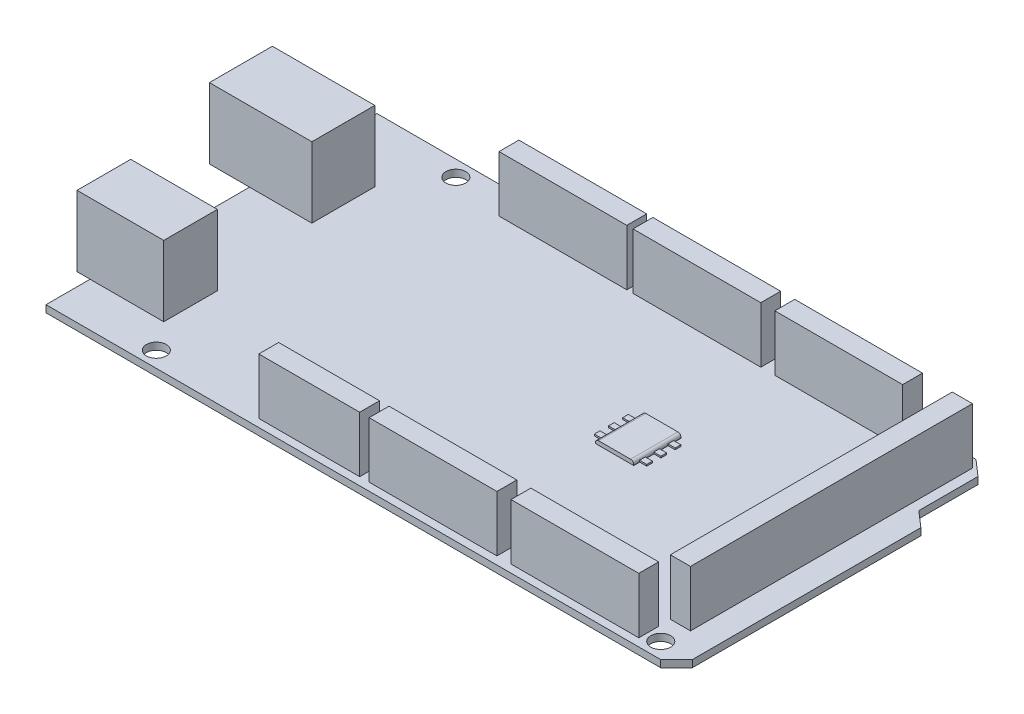
from build123d import *

# Parameters (mm, degrees)
SKETCH2_W           = 101.6
SKETCH2_H           = 53.34
BOSS_EXTRUDE1_DEPTH = 1.14
SKETCH3_R           = 1.6
CUT_EXTRUDE1_DEPTH  = 115.756329673
SKETCH4_W           = 20.59
SKETCH4_H           = 3.2
SKETCH4_W_2         = 16.256
BOSS_EXTRUDE2_DEPTH = 9
CUT_EXTRUDE2_DEPTH  = 116.10306512
SKETCH6_R           = 1.6
CUT_EXTRUDE3_DEPTH  = 116.10306512
SKETCH7_W           = 3.245231175
SKETCH7_H           = 45.43323645
BOSS_EXTRUDE3_DEPTH = 9
SKETCH8_W           = 16.51
SKETCH8_H           = 10.150135712
SKETCH8_W_2         = 13.97
SKETCH8_H_2         = 8.650400862
BOSS_EXTRUDE4_DEPTH = 11.36
SKETCH9_R           = 3.217681585
SKETCH9_R_2         = 1.182707285
CUT_EXTRUDE4_DEPTH  = 11.36
SKETCH10_W          = 6.35
SKETCH10_H          = 5.56209116
SKETCH10_W_2        = 5.200759748
SKETCH10_H_2        = 1.452464435
CUT_EXTRUDE5_DEPTH  = 11.36
CHAMFER1_SIZE       = 1.524
SKETCH11_W          = 6.176206758
SKETCH11_H          = 7.62
BOSS_EXTRUDE5_DEPTH = 0.635
SKETCH12_W          = 8.456815018
SKETCH12_H          = 0.915706085
BOSS_EXTRUDE6_DEPTH = 0.254
FILLET1_R           = 0.508


with BuildPart() as part:
    # Sketch2 → Boss-Extrude1 (new body)
    with BuildSketch(Plane(origin=(0, 0, 0), x_dir=(1, 0, 0), z_dir=(0, 1, 0))):
        with Locations((50.8, 26.67)):
            Rectangle(SKETCH2_W, SKETCH2_H)
    extrude(amount=BOSS_EXTRUDE1_DEPTH)

    # Sketch3 → Cut-Extrude1 (cut, through all)
    with BuildSketch(Plane(origin=(0, 1.14, 0), x_dir=(1, 0, 0), z_dir=(0, 1, 0))):
        with Locations(Location((15.24, 50.8, 0), (0, 0, 270))):
            Circle(SKETCH3_R)
        with Locations(Location((15.24, 2.54, 0), (0, 0, 90))):
            Circle(SKETCH3_R)
    extrude(amount=-CUT_EXTRUDE1_DEPTH, mode=Mode.SUBTRACT)

    # Sketch4 → Boss-Extrude2 (add)
    with BuildSketch(Plane(origin=(0, 1.14, 0), x_dir=(1, 0, 0), z_dir=(0, 1, 0))):
        with Locations((56.015, 50.47)):
            Rectangle(SKETCH4_W, SKETCH4_H)
        with Locations((34.425, 50.47)):
            Rectangle(SKETCH4_W, SKETCH4_H)
        with Locations((78.875, 50.47)):
            Rectangle(SKETCH4_W, SKETCH4_H)
        with Locations((83.955, 2.87)):
            Rectangle(SKETCH4_W, SKETCH4_H)
        with Locations((61.095, 2.87)):
            Rectangle(SKETCH4_W, SKETCH4_H)
        with Locations((41.148, 2.87)):
            Rectangle(SKETCH4_W_2, SKETCH4_H)
    extrude(amount=BOSS_EXTRUDE2_DEPTH)

    # Sketch5 → Cut-Extrude2 (cut, through all)
    with BuildSketch(Plane(origin=(0, 1.14, 0), x_dir=(1, 0, 0), z_dir=(0, 1, 0))):
        Polygon((99.06, 0), (101.6, 0), (101.6, 2.54), align=None)
        Polygon((99.06, 41.584296227), (101.6, 39.37), (101.6, 53.321621524), (101.6, 53.34), (96.536046111, 53.34), (96.536046111, 53.321621524), (99.06, 51.121313818), align=None)
    extrude(amount=-CUT_EXTRUDE2_DEPTH, mode=Mode.SUBTRACT)

    # Sketch6 → Cut-Extrude3 (cut, through all)
    with BuildSketch(Plane(origin=(0, 1.14, 0), x_dir=(1, 0, 0), z_dir=(0, 1, 0))):
        with Locations(Location((96.52, 2.54, 0), (0, 0, 270))):
            Circle(SKETCH6_R)
        with Locations(Location((91.44, 50.8, 0), (0, 0, 270))):
            Circle(SKETCH6_R)
    extrude(amount=-CUT_EXTRUDE3_DEPTH, mode=Mode.SUBTRACT)

    # Sketch7 → Boss-Extrude3 (add)
    with BuildSketch(Plane(origin=(0, 1.14, 0), x_dir=(1, 0, 0), z_dir=(0, 1, 0))):
        with Locations((95.826679511, 29.119940639)):
            Rectangle(SKETCH7_W, SKETCH7_H)
    extrude(amount=BOSS_EXTRUDE3_DEPTH)

    # Sketch8 → Boss-Extrude4 (add)
    with BuildSketch(Plane(origin=(0, 1.14, 0), x_dir=(1, 0, 0), z_dir=(0, 1, 0))):
        with Locations((1.785, 37.873809091)):
            Rectangle(SKETCH8_W, SKETCH8_H)
        with Locations((4.885, 11.42677262)):
            Rectangle(SKETCH8_W_2, SKETCH8_H_2)
    extrude(amount=BOSS_EXTRUDE4_DEPTH)

    # Sketch9 → Cut-Extrude4 (cut)
    with BuildSketch(Plane.ZY.offset(2.1)):
        with Locations((-11.42677262, 7.870480003)):
            Circle(SKETCH9_R)
        with Locations((-11.42677262, 7.870480003)):
            Circle(SKETCH9_R_2, mode=Mode.SUBTRACT)
    extrude(amount=-CUT_EXTRUDE4_DEPTH, mode=Mode.SUBTRACT)

    # Sketch10 → Cut-Extrude5 (cut)
    with BuildSketch(Plane.ZY.offset(6.47)):
        with Locations((-37.873809091, 6.856773581)):
            Rectangle(SKETCH10_W, SKETCH10_H)
        with Locations((-37.84018947, 5.332133236)):
            Rectangle(SKETCH10_W_2, SKETCH10_H_2, mode=Mode.SUBTRACT)
    extrude(amount=-CUT_EXTRUDE5_DEPTH, mode=Mode.SUBTRACT)

    # Chamfer1
    chamfer1_edges = [part.edges().sort_by_distance(p)[0] for p in [
        (-0.79, 9.637819161, -41.048809091),
        (-0.79, 9.637819161, -34.698809091),
    ]]
    chamfer(chamfer1_edges, length=CHAMFER1_SIZE)

    # Sketch11 → Boss-Extrude5 (add)
    with BuildSketch(Plane(origin=(0, 1.14, 0), x_dir=(1, 0, 0), z_dir=(0, 1, 0))):
        with Locations((66.718103379, 28.71)):
            Rectangle(SKETCH11_W, SKETCH11_H)
    extrude(amount=BOSS_EXTRUDE5_DEPTH)

    # Sketch12 → Boss-Extrude6 (add)
    with BuildSketch(Plane(origin=(0, 1.14, 0), x_dir=(1, 0, 0), z_dir=(0, 1, 0))):
        with Locations((66.71021047, 28.609003409)):
            Rectangle(SKETCH12_W, SKETCH12_H)
        with Locations((66.71021047, 30.895003409)):
            Rectangle(SKETCH12_W, SKETCH12_H)
        with Locations((66.71021047, 26.323003408)):
            Rectangle(SKETCH12_W, SKETCH12_H)
    extrude(amount=BOSS_EXTRUDE6_DEPTH)

    # Fillet1
    # the kernel refuses this fillet: 0.508 mm, written as the material it takes off along each edge
    with BuildSketch(Plane(origin=(69.806206758, 1.775, -33.79), x_dir=(0, -1, 0), z_dir=(0, 0, 1))) as fillet1_piece_1_section:
        with BuildLine():
            CenterArc((FILLET1_R, -FILLET1_R), FILLET1_R, 90, 90)
            Line((0, -FILLET1_R), (0, 0))
            Line((0, 0), (FILLET1_R, 0))
        make_face()
    fillet1_piece_1 = extrude(amount=10.16, mode=Mode.PRIVATE)
    fillet1_piece_1 = split(fillet1_piece_1, bisect_by=Plane(origin=(69.801380886, 1.362351692, -31.352856451), z_dir=(0, 0, -1)), keep=Keep.TOP, mode=Mode.PRIVATE)
    add(fillet1_piece_1, mode=Mode.SUBTRACT)
    with BuildSketch(Plane(origin=(69.806206758, 1.775, -33.79), x_dir=(0, -1, 0), z_dir=(0, 0, 1))) as fillet1_piece_2_section:
        with BuildLine():
            CenterArc((FILLET1_R, -FILLET1_R), FILLET1_R, 90, 90)
            Line((0, -FILLET1_R), (0, 0))
            Line((0, 0), (FILLET1_R, 0))
        make_face()
    fillet1_piece_2 = extrude(amount=10.16, mode=Mode.PRIVATE)
    fillet1_piece_2 = split(fillet1_piece_2, bisect_by=Plane(origin=(69.691388297, 1.394, -30.895003408), z_dir=(0, 1, 0)), keep=Keep.TOP, mode=Mode.PRIVATE)
    add(fillet1_piece_2, mode=Mode.SUBTRACT)
    with BuildSketch(Plane(origin=(69.806206758, 1.775, -33.79), x_dir=(0, -1, 0), z_dir=(0, 0, 1))) as fillet1_piece_3_section:
        with BuildLine():
            CenterArc((FILLET1_R, -FILLET1_R), FILLET1_R, 90, 90)
            Line((0, -FILLET1_R), (0, 0))
            Line((0, 0), (FILLET1_R, 0))
        make_face()
    fillet1_piece_3 = extrude(amount=10.16, mode=Mode.PRIVATE)
    fillet1_piece_3 = split(fillet1_piece_3, bisect_by=Plane(origin=(69.801380886, 1.362351692, -29.066856451), z_dir=(0, 0, -1)), keep=Keep.TOP, mode=Mode.PRIVATE)
    fillet1_piece_3 = split(fillet1_piece_3, bisect_by=Plane(origin=(69.801380886, 1.362351692, -30.437150366), z_dir=(0, 0, 1)), keep=Keep.TOP, mode=Mode.PRIVATE)
    add(fillet1_piece_3, mode=Mode.SUBTRACT)
    with BuildSketch(Plane(origin=(69.806206758, 1.775, -33.79), x_dir=(0, -1, 0), z_dir=(0, 0, 1))) as fillet1_piece_4_section:
        with BuildLine():
            CenterArc((FILLET1_R, -FILLET1_R), FILLET1_R, 90, 90)
            Line((0, -FILLET1_R), (0, 0))
            Line((0, 0), (FILLET1_R, 0))
        make_face()
    fillet1_piece_4 = extrude(amount=10.16, mode=Mode.PRIVATE)
    fillet1_piece_4 = split(fillet1_piece_4, bisect_by=Plane(origin=(69.801380886, 1.362351692, -26.780856451), z_dir=(0, 0, -1)), keep=Keep.TOP, mode=Mode.PRIVATE)
    fillet1_piece_4 = split(fillet1_piece_4, bisect_by=Plane(origin=(69.801380886, 1.362351692, -28.151150366), z_dir=(0, 0, 1)), keep=Keep.TOP, mode=Mode.PRIVATE)
    add(fillet1_piece_4, mode=Mode.SUBTRACT)
    with BuildSketch(Plane(origin=(69.806206758, 1.775, -33.79), x_dir=(0, -1, 0), z_dir=(0, 0, 1))) as fillet1_piece_5_section:
        with BuildLine():
            CenterArc((FILLET1_R, -FILLET1_R), FILLET1_R, 90, 90)
            Line((0, -FILLET1_R), (0, 0))
            Line((0, 0), (FILLET1_R, 0))
        make_face()
    fillet1_piece_5 = extrude(amount=10.16, mode=Mode.PRIVATE)
    fillet1_piece_5 = split(fillet1_piece_5, bisect_by=Plane(origin=(69.801380886, 1.362351692, -25.865150366), z_dir=(0, 0, 1)), keep=Keep.TOP, mode=Mode.PRIVATE)
    add(fillet1_piece_5, mode=Mode.SUBTRACT)
    with BuildSketch(Plane(origin=(63.63, 1.775, -23.63), x_dir=(0, -1, 0), z_dir=(0, 0, -1))) as fillet1_piece_6_section:
        with BuildLine():
            CenterArc((FILLET1_R, -FILLET1_R), FILLET1_R, 90, 90)
            Line((0, -FILLET1_R), (0, 0))
            Line((0, 0), (FILLET1_R, 0))
        make_face()
    fillet1_piece_6 = extrude(amount=10.16, mode=Mode.PRIVATE)
    fillet1_piece_6 = split(fillet1_piece_6, bisect_by=Plane(origin=(63.634825872, 1.362351692, -25.865150366), z_dir=(0, 0, 1)), keep=Keep.TOP, mode=Mode.PRIVATE)
    add(fillet1_piece_6, mode=Mode.SUBTRACT)
    with BuildSketch(Plane(origin=(63.63, 1.775, -23.63), x_dir=(0, -1, 0), z_dir=(0, 0, -1))) as fillet1_piece_7_section:
        with BuildLine():
            CenterArc((FILLET1_R, -FILLET1_R), FILLET1_R, 90, 90)
            Line((0, -FILLET1_R), (0, 0))
            Line((0, 0), (FILLET1_R, 0))
        make_face()
    fillet1_piece_7 = extrude(amount=10.16, mode=Mode.PRIVATE)
    fillet1_piece_7 = split(fillet1_piece_7, bisect_by=Plane(origin=(63.744818461, 1.394, -26.323003408), z_dir=(0, 1, 0)), keep=Keep.TOP, mode=Mode.PRIVATE)
    add(fillet1_piece_7, mode=Mode.SUBTRACT)
    with BuildSketch(Plane(origin=(63.63, 1.775, -23.63), x_dir=(0, -1, 0), z_dir=(0, 0, -1))) as fillet1_piece_8_section:
        with BuildLine():
            CenterArc((FILLET1_R, -FILLET1_R), FILLET1_R, 90, 90)
            Line((0, -FILLET1_R), (0, 0))
            Line((0, 0), (FILLET1_R, 0))
        make_face()
    fillet1_piece_8 = extrude(amount=10.16, mode=Mode.PRIVATE)
    fillet1_piece_8 = split(fillet1_piece_8, bisect_by=Plane(origin=(63.634825872, 1.362351692, -28.151150366), z_dir=(0, 0, 1)), keep=Keep.TOP, mode=Mode.PRIVATE)
    fillet1_piece_8 = split(fillet1_piece_8, bisect_by=Plane(origin=(63.634825872, 1.362351692, -26.780856451), z_dir=(0, 0, -1)), keep=Keep.TOP, mode=Mode.PRIVATE)
    add(fillet1_piece_8, mode=Mode.SUBTRACT)
    with BuildSketch(Plane(origin=(63.63, 1.775, -23.63), x_dir=(0, -1, 0), z_dir=(0, 0, -1))) as fillet1_piece_9_section:
        with BuildLine():
            CenterArc((FILLET1_R, -FILLET1_R), FILLET1_R, 90, 90)
            Line((0, -FILLET1_R), (0, 0))
            Line((0, 0), (FILLET1_R, 0))
        make_face()
    fillet1_piece_9 = extrude(amount=10.16, mode=Mode.PRIVATE)
    fillet1_piece_9 = split(fillet1_piece_9, bisect_by=Plane(origin=(63.634825872, 1.362351692, -30.437150366), z_dir=(0, 0, 1)), keep=Keep.TOP, mode=Mode.PRIVATE)
    fillet1_piece_9 = split(fillet1_piece_9, bisect_by=Plane(origin=(63.634825872, 1.362351692, -29.066856451), z_dir=(0, 0, -1)), keep=Keep.TOP, mode=Mode.PRIVATE)
    add(fillet1_piece_9, mode=Mode.SUBTRACT)
    with BuildSketch(Plane(origin=(63.63, 1.775, -23.63), x_dir=(0, -1, 0), z_dir=(0, 0, -1))) as fillet1_piece_10_section:
        with BuildLine():
            CenterArc((FILLET1_R, -FILLET1_R), FILLET1_R, 90, 90)
            Line((0, -FILLET1_R), (0, 0))
            Line((0, 0), (FILLET1_R, 0))
        make_face()
    fillet1_piece_10 = extrude(amount=10.16, mode=Mode.PRIVATE)
    fillet1_piece_10 = split(fillet1_piece_10, bisect_by=Plane(origin=(63.634825872, 1.362351692, -31.352856451), z_dir=(0, 0, -1)), keep=Keep.TOP, mode=Mode.PRIVATE)
    add(fillet1_piece_10, mode=Mode.SUBTRACT)


solid = part.part
